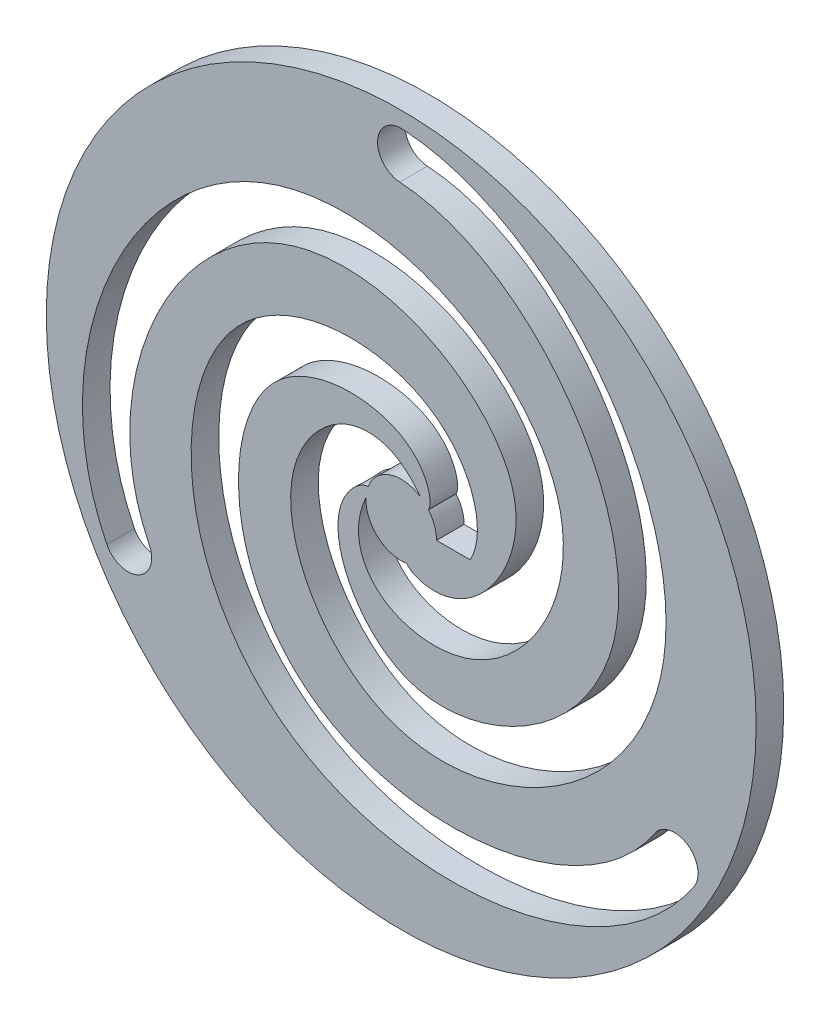
from build123d import *

# Parameters (mm, degrees)
CROQUIS1_R            = 45
DISK_DEPTH            = 3.5
CORTAR_EXTRUIR1_DEPTH = 10


with BuildPart() as part:
    # Croquis1 → Disk (new body)
    with BuildSketch(Plane.XY):
        Circle(CROQUIS1_R)
    extrude(amount=DISK_DEPTH)

    # Croquis6 → Cortar-Extruir1 (cut)
    with BuildSketch(Plane.XY.offset(3.5)):
        with BuildLine():
            ThreePointArc((3.459524794, 2.841324786), (4.214790805, 1.508965476), (4.476766505, 0))
            Line((4.476766505, 0), (4.792155804, 0))
            add(Edge.make_bspline(
                [(32.83671682, -22.396769476), (21.741935644, -35.440678016), (-11.620262743, -38.144723781), (-26.036880687, -9.032532818), (-21.03923879, 10.426049636), (-5.950513611, 15.235806559), (6.053632705, 10.885712666), (7.578225886, 1.886127889), (4.792155804, 0)],
                knots=[0.023053118, 0.023053118, 0.023053118, 0.023053118, 0.418034013, 0.568628946, 0.71922388, 0.812318353, 0.905412827, 0.979883664, 0.979883664, 0.979883664, 0.979883664], degree=3))
            ThreePointArc((32.83671682, -22.396769476), (31.68444949, -20.508638943), (32.139489045, -18.343992109))
            add(Edge.make_bspline(
                [(32.139489045, -18.343992109), (30.816581859, -20.342345016), (27.533059547, -23.862014952), (21.017358759, -27.759699433), (13.468381143, -30.090828473), (5.490835253, -30.755005259), (-2.281187715, -29.695369598), (-9.240042266, -26.916093066), (-14.809528654, -22.476742874), (-18.795848788, -16.322196042), (-20.840898309, -9.059026696), (-20.587059721, -1.125458438), (-18.332766438, 4.591947958), (-15.513610929, 7.794024391), (-12.793580244, 9.536490831), (-9.515941254, 10.621280853), (-5.951549179, 10.932045647), (-2.383823726, 10.418838353), (0.117272846, 9.306768493), (1.67079673, 8.055493614), (2.604637583, 6.941971378), (3.328256936, 5.570328577), (3.691809526, 4.201659392), (3.646159977, 3.253966347), (3.526708789, 2.951561667), (3.459524794, 2.841324786)],
                knots=[0, 0, 0, 0, 0.0625, 0.125, 0.1875, 0.25, 0.3125, 0.375, 0.4375, 0.5, 0.5625, 0.625, 0.6875, 0.71875, 0.75, 0.78125, 0.8125, 0.84375, 0.875, 0.890625, 0.90625, 0.921875, 0.9375, 0.953125, 0.965421832, 0.965421832, 0.965421832, 0.965421832], degree=3))
        make_face()
        with BuildLine():
            ThreePointArc((32.83671682, -22.396769476), (35.149655094, -22.956566662), (37.142543258, -21.656007891))
            ThreePointArc((37.142543258, -21.656007891), (37.5136962, -20.864701879), (37.641016151, -20))
            ThreePointArc((37.641016151, -20), (35.505718031, -17.127319952), (32.139489045, -18.343992109))
            ThreePointArc((32.139489045, -18.343992109), (31.68444949, -20.508638943), (32.83671682, -22.396769476))
        make_face()
        with BuildLine():
            add(Edge.make_bspline(
                [(32.83671682, -22.396769476), (21.741935644, -35.440678016), (-11.620262743, -38.144723781), (-26.036880687, -9.032532818), (-21.03923879, 10.426049636), (-5.950513611, 15.235806559), (6.053632705, 10.885712666), (7.578225886, 1.886127889), (4.792155804, 0)],
                knots=[0.023053118, 0.023053118, 0.023053118, 0.023053118, 0.418034013, 0.568628946, 0.71922388, 0.812318353, 0.905412827, 0.979883664, 0.979883664, 0.979883664, 0.979883664], degree=3))
            Line((4.792155804, 0), (8.741306197, 0))
            add(Edge.make_bspline(
                [(37.142543258, -21.656007891), (36.305969693, -22.919716512), (34.412867817, -25.317401031), (29.98574423, -29.416909666), (23.435691584, -33.311018862), (14.603463126, -36.028815624), (5.353640577, -36.799546216), (-3.771774538, -35.567859483), (-10.812007742, -32.776147426), (-15.790507585, -29.406997191), (-20.195841874, -25.247763681), (-24.355089103, -18.817653065), (-26.888257626, -9.771909548), (-26.638064079, -1.642609101), (-24.863232673, 4.511285255), (-22.668188937, 8.754317763), (-19.477229889, 12.407198493), (-15.346857795, 15.038476232), (-10.711976694, 16.552862552), (-5.796008093, 16.980079989), (-0.808615434, 16.281190532), (3.135718873, 14.578252293), (5.881015422, 12.388651613), (7.631974777, 10.296664232), (8.937070144, 7.825698592), (9.693629705, 5.097006727), (9.70561681, 2.41665512), (9.110305968, 0.680512512), (8.741306197, 0)],
                knots=[0, 0, 0, 0, 0.03125, 0.0625, 0.125, 0.1875, 0.25, 0.3125, 0.375, 0.40625, 0.4375, 0.5, 0.5625, 0.625, 0.65625, 0.6875, 0.71875, 0.75, 0.78125, 0.8125, 0.84375, 0.875, 0.890625, 0.90625, 0.921875, 0.9375, 0.953125, 0.964246354, 0.964246354, 0.964246354, 0.964246354], degree=3))
            ThreePointArc((37.142543258, -21.656007891), (35.149655094, -22.956566662), (32.83671682, -22.396769476))
        make_face()
        with BuildLine():
            add(Edge.make_bspline(
                [(-37.325924607, -21.338382077), (-38.002041594, -19.982033808), (-39.131946359, -17.143717231), (-40.468663186, -11.259961422), (-40.566034352, -3.640394836), (-38.503601162, 5.367437762), (-34.546162159, 13.763384365), (-28.916782602, 21.050382309), (-22.978972438, 25.751547083), (-17.571952824, 28.378479302), (-11.767283799, 30.113993954), (-4.119021043, 30.500952407), (4.981406901, 28.171868942), (11.89649083, 23.89054475), (16.338503971, 19.276548488), (18.915556044, 15.254068596), (20.483564029, 10.664176633), (20.697131349, 5.771530603), (19.949678953, 2.226417543), (19.265095132, 0.347251662), (19.128163443, 0)],
                knots=[0, 0, 0, 0, 0.03125, 0.0625, 0.125, 0.1875, 0.25, 0.3125, 0.375, 0.40625, 0.4375, 0.5, 0.5625, 0.625, 0.65625, 0.6875, 0.71875, 0.75, 0.78125, 0.788409638, 0.788409638, 0.788409638, 0.788409638], degree=3))
            ThreePointArc((-37.325924607, -21.338382077), (-37.45579746, -18.962210915), (-35.814529739, -17.239046205))
            add(Edge.make_bspline(
                [(-35.814529739, -17.239046205), (-41.563495311, -1.108729587), (-27.224168443, 29.135804624), (5.196037463, 27.064866519), (19.001898406, 13.543177295), (17.362358663, 3.183214864), (15.86171496, 0)],
                knots=[0.023053118, 0.023053118, 0.023053118, 0.023053118, 0.418034013, 0.568628946, 0.71922388, 0.797293292, 0.797293292, 0.797293292, 0.797293292], degree=3))
            Line((15.86171496, 0), (19.128163443, 0))
        make_face()
        with BuildLine():
            add(Edge.make_bspline(
                [(0.183381349, 42.994389968), (1.6960719, 42.90175032), (4.719078542, 42.461118262), (10.482918956, 40.676871087), (17.130342768, 36.951413698), (23.900138036, 30.661377863), (29.192521582, 23.03616185), (32.68855714, 14.517477174), (33.79098018, 7.024600342), (33.362460409, 1.028517888), (31.963125673, -4.866230273), (28.474110145, -11.683299342), (21.906850725, -18.399959394), (14.741573249, -22.24793565), (8.524728702, -23.787833742), (3.752632893, -24.008386359), (-1.00633414, -23.071375125), (-5.350273554, -20.810006835), (-8.979211128, -17.553275218), (-11.807176582, -13.509530244), (-13.695616887, -8.840876774), (-14.192996265, -4.573513943), (-13.669394726, -1.101217051), (-12.733160187, 1.461151922), (-11.245788855, 3.826880484), (-9.260952161, 5.846426216), (-6.699604548, 7.340533679), (-3.985445635, 7.73241613), (-1.747912594, 7.205889757), (-0.177132177, 6.40645148), (0.991896426, 5.448186257), (1.837523993, 4.535517661), (2.240116248, 4.021322021), (2.429225007, 3.760359585)],
                knots=[0, 0, 0, 0, 0.03125, 0.0625, 0.125, 0.1875, 0.25, 0.3125, 0.375, 0.40625, 0.4375, 0.5, 0.5625, 0.625, 0.65625, 0.6875, 0.71875, 0.75, 0.78125, 0.8125, 0.84375, 0.875, 0.890625, 0.90625, 0.921875, 0.9375, 0.953125, 0.96875, 0.9765625, 0.984375, 0.9921875, 0.99609375, 1, 1, 1, 1], degree=3))
            ThreePointArc((0.183381349, 42.994389968), (2.185193818, 42.055462959), (3, 40))
            ThreePointArc((3, 40), (2.994448093, 39.817570229), (2.977812919, 39.635815681))
            add(Edge.make_bspline(
                [(2.977812919, 39.635815681), (19.821559667, 36.549407603), (33.593560596, 16.61090189), (30, 0)],
                knots=[0.023053118, 0.023053118, 0.023053118, 0.023053118, 0.418034013, 0.418034013, 0.418034013, 0.418034013], degree=3))
            add(Edge.make_bspline(
                [(30, 0), (28.629877986, -6.33326244), (20.840843224, -18.032333701), (1.490395549, -23.433540087), (-10.219338721, -12.771199232), (-12.477477655, -0.068867044), (-5.191662138, 5.808528711), (-2.064407127, 3.972362213)],
                knots=[0.418034013, 0.418034013, 0.418034013, 0.418034013, 0.568628946, 0.71922388, 0.812318353, 0.905412827, 0.98260804, 0.98260804, 0.98260804, 0.98260804], degree=3))
            ThreePointArc((-2.064407127, 3.972362213), (0.210972273, 4.471792598), (2.429225007, 3.760359585))
        make_face()
        with BuildLine():
            add(Edge.make_bspline(
                [(-31.956107696, -18.661617923), (-33.025278486, -16.51677024), (-34.431640908, -11.913321535), (-34.54928429, -4.321716889), (-32.79361245, 3.381454019), (-29.380033474, 10.622299812), (-24.576350589, 16.823251311), (-18.689999233, 21.460157867), (-12.060665996, 24.063799469), (-4.737512024, 24.438780557), (2.575101902, 22.578260722), (9.318854263, 18.391645926), (13.143126804, 13.580667477), (14.506628584, 9.538168973), (14.655633445, 6.311320082), (13.974869686, 3.020323963), (13.027177655, 0.941521221), (12.470967472, 0)],
                knots=[0, 0, 0, 0, 0.0625, 0.125, 0.1875, 0.25, 0.3125, 0.375, 0.4375, 0.5, 0.5625, 0.625, 0.6875, 0.71875, 0.75, 0.78125, 0.81000666, 0.81000666, 0.81000666, 0.81000666], degree=3))
            Line((12.470967472, 0), (15.86171496, 0))
            add(Edge.make_bspline(
                [(-35.814529739, -17.239046205), (-41.563495311, -1.108729587), (-27.224168443, 29.135804624), (5.196037463, 27.064866519), (19.001898406, 13.543177295), (17.362358663, 3.183214864), (15.86171496, 0)],
                knots=[0.023053118, 0.023053118, 0.023053118, 0.023053118, 0.418034013, 0.568628946, 0.71922388, 0.797293292, 0.797293292, 0.797293292, 0.797293292], degree=3))
            ThreePointArc((-35.814529739, -17.239046205), (-33.603227066, -17.185218692), (-31.956107696, -18.661617923))
        make_face()
        with BuildLine():
            Line((15.86171496, 0), (12.470967472, 0))
            add(Edge.make_bspline(
                [(12.470967472, 0), (12.422741384, -0.0816344), (11.759696134, -1.180860054), (10.214890554, -3.144967272), (8.001261519, -4.75494551), (6.140863745, -5.47469922), (4.709604774, -5.726668004), (3.159917587, -5.667519346), (1.792839008, -5.298030531), (0.994937531, -4.78465034), (0.79277299, -4.530000236), (0.730897048, -4.41669875)],
                knots=[0.81000666, 0.81000666, 0.81000666, 0.81000666, 0.8125, 0.84375, 0.875, 0.890625, 0.90625, 0.921875, 0.9375, 0.953125, 0.965421832, 0.965421832, 0.965421832, 0.965421832], degree=3))
            ThreePointArc((0.730897048, -4.41669875), (-0.897997629, -4.385776852), (-2.407963026, -3.774010122))
            add(Edge.make_bspline(
                [(15.86171496, 0), (15.572904495, -0.612634274), (13.243859789, -4.926808513), (6.298379437, -10.771379102), (-2.434502354, -7.400375655), (-2.407963026, -3.774010122)],
                knots=[0.797293292, 0.797293292, 0.797293292, 0.797293292, 0.812318353, 0.905412827, 0.98260804, 0.98260804, 0.98260804, 0.98260804], degree=3))
        make_face()
        with BuildLine():
            ThreePointArc((-4.190421842, 1.575373964), (-3.349195355, 2.970577185), (-2.064407127, 3.972362213))
            add(Edge.make_bspline(
                [(30, 0), (28.629877986, -6.33326244), (20.840843224, -18.032333701), (1.490395549, -23.433540087), (-10.219338721, -12.771199232), (-12.477477655, -0.068867044), (-5.191662138, 5.808528711), (-2.064407127, 3.972362213)],
                knots=[0.418034013, 0.418034013, 0.418034013, 0.418034013, 0.568628946, 0.71922388, 0.812318353, 0.905412827, 0.98260804, 0.98260804, 0.98260804, 0.98260804], degree=3))
            Line((30, 0), (26.918578547, 0))
            add(Edge.make_bspline(
                [(26.918578547, 0), (26.794060241, -0.504450239), (26.00202511, -3.285893734), (23.533360812, -8.116584515), (18.265796407, -13.519234025), (11.268205458, -17.266187489), (5.189639634, -18.172615436), (1.006982344, -17.332193364), (-1.8620532, -15.847810912), (-4.440328413, -13.551687293), (-6.491654656, -10.620215604), (-7.831066829, -7.273871081), (-8.118534365, -4.551822983), (-7.811660475, -2.580794394), (-7.314242358, -1.215303374), (-6.488174523, 0.097190768), (-5.484648534, 1.096371139), (-4.641097508, 1.530683992), (-4.319481779, 1.57843857), (-4.190421842, 1.575373964)],
                knots=[0.423783307, 0.423783307, 0.423783307, 0.423783307, 0.4375, 0.5, 0.5625, 0.625, 0.6875, 0.71875, 0.75, 0.78125, 0.8125, 0.84375, 0.875, 0.890625, 0.90625, 0.921875, 0.9375, 0.953125, 0.965421832, 0.965421832, 0.965421832, 0.965421832], degree=3))
        make_face()
        with BuildLine():
            ThreePointArc((3, 40), (2.185193818, 42.055462959), (0.183381349, 42.994389968))
            ThreePointArc((0.183381349, 42.994389968), (-2.994389968, 40.183381349), (-0.183381349, 37.005610032))
            ThreePointArc((-0.183381349, 37.005610032), (1.918777577, 37.693857634), (2.977812919, 39.635815681))
            ThreePointArc((2.977812919, 39.635815681), (2.994448093, 39.817570229), (3, 40))
        make_face()
        with BuildLine():
            Line((19.128163443, 0), (15.86171496, 0))
            add(Edge.make_bspline(
                [(15.86171496, 0), (15.572904495, -0.612634274), (13.243859789, -4.926808513), (6.298379437, -10.771379102), (-2.434502354, -7.400375655), (-2.407963026, -3.774010122)],
                knots=[0.797293292, 0.797293292, 0.797293292, 0.797293292, 0.812318353, 0.905412827, 0.98260804, 0.98260804, 0.98260804, 0.98260804], degree=3))
            ThreePointArc((-2.407963026, -3.774010122), (-3.978172127, -2.053188951), (-4.471179431, 0.223590775))
            add(Edge.make_bspline(
                [(19.128163443, 0), (18.667423134, -1.16841353), (17.366519313, -3.773718537), (14.504232321, -7.440313758), (11.057277392, -10.00473835), (7.788379305, -11.287434561), (5.101185411, -11.757816153), (2.308718711, -11.652579076), (-0.432677544, -10.943432943), (-3.00728637, -9.472294574), (-4.703745984, -7.31770523), (-5.36652729, -5.116681588), (-5.459583641, -3.356626705), (-5.214215916, -1.865085626), (-4.84663551, -0.676416372), (-4.602625151, -0.070663432), (-4.471179431, 0.223590775)],
                knots=[0.788409638, 0.788409638, 0.788409638, 0.788409638, 0.8125, 0.84375, 0.875, 0.890625, 0.90625, 0.921875, 0.9375, 0.953125, 0.96875, 0.9765625, 0.984375, 0.9921875, 0.99609375, 1, 1, 1, 1], degree=3))
        make_face()
        with BuildLine():
            ThreePointArc((-31.641016151, -20), (-31.720851313, -19.31251377), (-31.956107696, -18.661617923))
            ThreePointArc((-31.956107696, -18.661617923), (-33.603227066, -17.185218692), (-35.814529739, -17.239046205))
            ThreePointArc((-35.814529739, -17.239046205), (-37.45579746, -18.962210915), (-37.325924607, -21.338382077))
            ThreePointArc((-37.325924607, -21.338382077), (-33.953529921, -22.920164838), (-31.641016151, -20))
        make_face()
        with BuildLine():
            Line((26.918578547, 0), (30, 0))
            add(Edge.make_bspline(
                [(2.977812919, 39.635815681), (19.821559667, 36.549407603), (33.593560596, 16.61090189), (30, 0)],
                knots=[0.023053118, 0.023053118, 0.023053118, 0.023053118, 0.418034013, 0.418034013, 0.418034013, 0.418034013], degree=3))
            ThreePointArc((2.977812919, 39.635815681), (1.918777577, 37.693857634), (-0.183381349, 37.005610032))
            add(Edge.make_bspline(
                [(-0.183381349, 37.005610032), (2.208696627, 36.859115256), (6.898581361, 35.775336488), (13.531925531, 32.081416322), (19.325231307, 26.709374454), (23.889198221, 20.132705446), (26.857538304, 12.872118287), (27.851581779, 5.998471244), (27.361426877, 1.79407313), (26.918578547, 0)],
                knots=[0, 0, 0, 0, 0.0625, 0.125, 0.1875, 0.25, 0.3125, 0.375, 0.423783307, 0.423783307, 0.423783307, 0.423783307], degree=3))
        make_face()
    extrude(amount=-CORTAR_EXTRUIR1_DEPTH, mode=Mode.SUBTRACT)


solid = part.part
